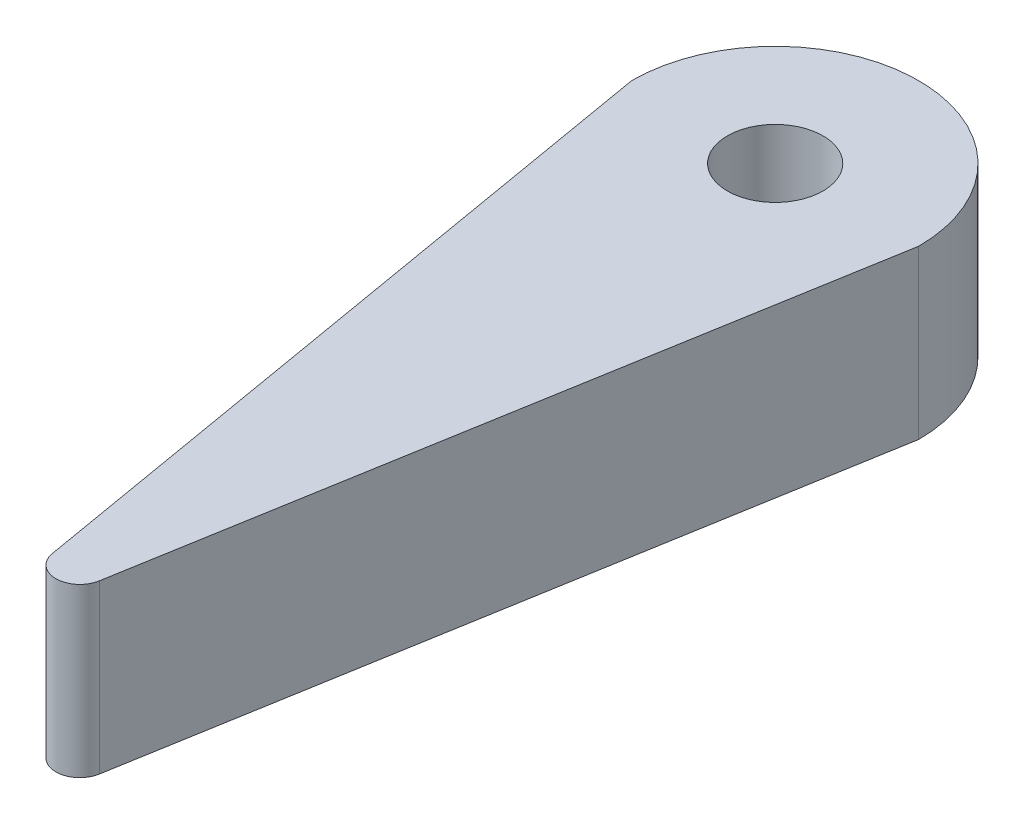
from build123d import *

# Parameters (mm, degrees)
SKETCH2_R           = 4
BOSS_EXTRUDE1_DEPTH = 14
FILLET1_R           = 2


with BuildPart() as part:
    # Sketch2 → Boss-Extrude1 (new body)
    with BuildSketch(Plane(origin=(0, 0, 0), x_dir=(1, 0, 0), z_dir=(0, 1, 0))):
        with BuildLine():
            Line((-12, 0), (0, -70))
            Line((0, -70), (12, 0))
            ThreePointArc((12, 0), (0, 12), (-12, 0))
        make_face()
        Circle(SKETCH2_R, mode=Mode.SUBTRACT)
    extrude(amount=BOSS_EXTRUDE1_DEPTH)

    # Fillet1
    fillet1_edges = [part.edges().sort_by_distance(p)[0] for p in [
        (0, 7, 70),
    ]]
    fillet(fillet1_edges, radius=FILLET1_R)


solid = part.part
